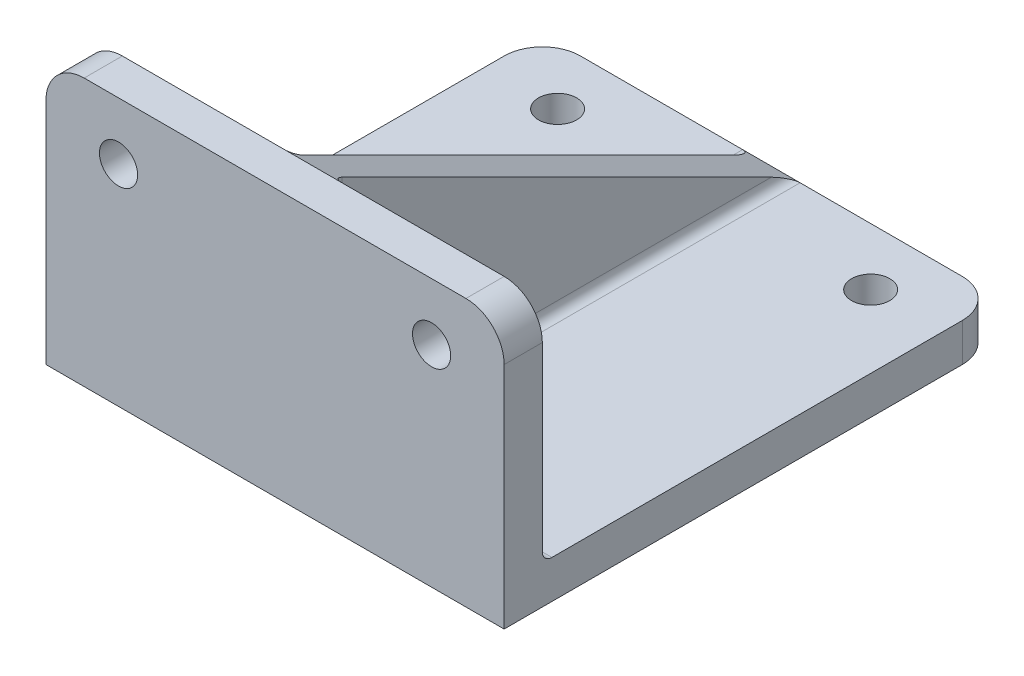
from build123d import *

# Parameters (mm, degrees)
EXTRUDE_THIN1_DEPTH = 76.2
FILLET1_R           = 6.35
SKETCH2_R           = 3.175
CUT_EXTRUDE1_DEPTH  = 76.2
SKETCH3_R           = 3.175
CUT_EXTRUDE2_DEPTH  = 115.3
BOSS_EXTRUDE1_REACH = 106.302
SKETCH4_W           = 6.35
SKETCH4_H           = 85.194189943
FILLET2_R           = 1.6002


with BuildPart() as part:
    # Sketch1 → Extrude-Thin1 (new body)
    with BuildSketch(Plane(origin=(0, 0, 0), x_dir=(0, 0, -1), z_dir=(1, 0, 0))):
        Polygon((76.2, 0), (0, 0), (0, 38.1), (-6.35, 38.1), (-6.35, -6.35), (76.2, -6.35), align=None)
    extrude(amount=EXTRUDE_THIN1_DEPTH)

    # Fillet1
    fillet1_edges = [part.edges().sort_by_distance(p)[0] for p in [
        (0, -3.175, -76.2),
        (76.2, -3.175, -76.2),
        (0, 38.1, 3.175),
        (76.2, 38.1, 3.175),
    ]]
    fillet(fillet1_edges, radius=FILLET1_R)

    # Sketch2 → Cut-Extrude1 (cut)
    with BuildSketch(Plane.XY):
        with Locations((12.065, 28.575)):
            Circle(SKETCH2_R)
        with Locations((64.135, 28.575)):
            Circle(SKETCH2_R)
    extrude(amount=CUT_EXTRUDE1_DEPTH, mode=Mode.SUBTRACT)

    # Sketch3 → Cut-Extrude2 (cut, through all)
    with BuildSketch(Plane(origin=(0, 0, 0), x_dir=(1, 0, 0), z_dir=(0, 1, 0))):
        with Locations((12.065, 66.675)):
            Circle(SKETCH3_R)
        with Locations((64.135, 66.675)):
            Circle(SKETCH3_R)
    extrude(amount=-CUT_EXTRUDE2_DEPTH, mode=Mode.SUBTRACT)

    # Sketch4 → Boss-Extrude1 (add, up to next)
    with BuildSketch(Plane(origin=(0, 30.48, -15.24), x_dir=(1, 0, 0), z_dir=(0, -0.894427190999916, 0.4472135954999579)), mode=Mode.PRIVATE) as boss_extrude1_sk1:
        with Locations((38.1, -25.558256983)):
            Rectangle(SKETCH4_W, SKETCH4_H)
    boss_extrude1_tool1 = extrude(boss_extrude1_sk1.sketch, amount=BOSS_EXTRUDE1_REACH, mode=Mode.PRIVATE) - part.part
    add(boss_extrude1_tool1.solids().sort_by_distance((38.1, 19.05, -38.1))[0])

    # Fillet2
    fillet2_edges = [part.edges().sort_by_distance(p)[0] for p in [
        (58.7375, 0, 0),
        (41.275, 0, -38.1),
        (41.275, 19.05, 0),
        (17.4625, 0, 0),
        (34.925, 0, -38.1),
        (34.925, 19.05, 0),
    ]]
    fillet(fillet2_edges, radius=FILLET2_R)


solid = part.part
